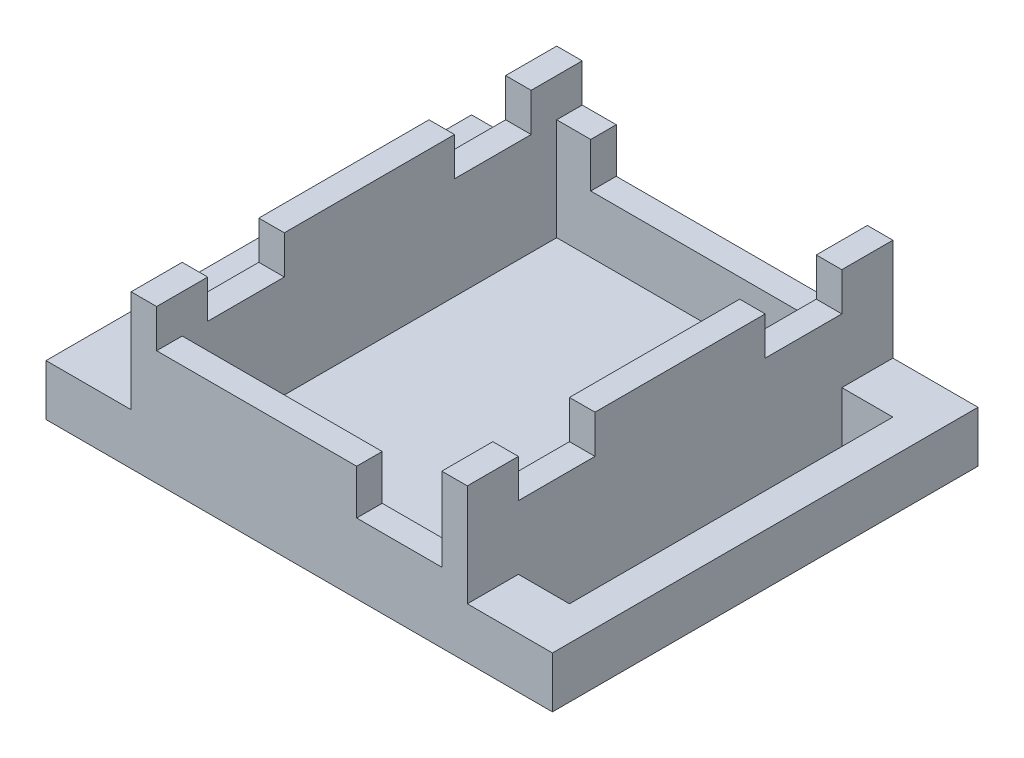
from build123d import *

# Parameters (mm, degrees)
SKETCH1_W           = 39.5
SKETCH1_H           = 50
BOSS_EXTRUDE1_DEPTH = 1.5
SKETCH3_W           = 39.5
SKETCH3_H           = 50
SKETCH3_W_2         = 33.5
SKETCH3_H_2         = 44
BOSS_EXTRUDE2_DEPTH = 12
SKETCH6_W           = 10
SKETCH6_H           = 6
CUT_EXTRUDE2_DEPTH  = 11.2
SKETCH7_W           = 29.5
SKETCH7_H           = 5.98
CUT_EXTRUDE3_DEPTH  = 3.3
SKETCH8_W           = 6
SKETCH8_H           = 6
BOSS_EXTRUDE3_DEPTH = 10
SKETCH9_W           = 4
SKETCH9_H           = 6
BOSS_EXTRUDE4_DEPTH = 38
SKETCH10_W          = 6
SKETCH10_H          = 6
BOSS_EXTRUDE5_DEPTH = 10
SKETCH11_W          = 4
SKETCH11_H          = 6
BOSS_EXTRUDE6_DEPTH = 38
SKETCH12_W          = 3
SKETCH12_H          = 6
SKETCH12_H_2        = 20
BOSS_EXTRUDE7_DEPTH = 4.5


with BuildPart() as part:
    # Sketch1 → Boss-Extrude1 (new body)
    with BuildSketch(Plane(origin=(0, 0, 0), x_dir=(1, 0, 0), z_dir=(0, 1, 0))):
        with Locations((19.75, 25)):
            Rectangle(SKETCH1_W, SKETCH1_H)
    extrude(amount=BOSS_EXTRUDE1_DEPTH)

    # Sketch3 → Boss-Extrude2 (add)
    with BuildSketch(Plane(origin=(0, 1.5, 0), x_dir=(1, 0, 0), z_dir=(0, 1, 0))):
        with Locations((19.75, 25)):
            Rectangle(SKETCH3_W, SKETCH3_H)
        with Locations((19.75, 25)):
            Rectangle(SKETCH3_W_2, SKETCH3_H_2, mode=Mode.SUBTRACT)
    extrude(amount=BOSS_EXTRUDE2_DEPTH)

    # Sketch6 → Cut-Extrude2 (cut)
    with BuildSketch(Plane.XY):
        with Locations((31.5, 11.23)):
            Rectangle(SKETCH6_W, SKETCH6_H)
    extrude(amount=-CUT_EXTRUDE2_DEPTH, mode=Mode.SUBTRACT)

    # Sketch7 → Cut-Extrude3 (cut)
    with BuildSketch(Plane(origin=(0, 0, -50), x_dir=(-1, 0, 0), z_dir=(0, 0, -1))):
        with Locations((-21.75, 11.24)):
            Rectangle(SKETCH7_W, SKETCH7_H)
    extrude(amount=-CUT_EXTRUDE3_DEPTH, mode=Mode.SUBTRACT)

    # Sketch8 → Boss-Extrude3 (add)
    with BuildSketch(Plane(origin=(39.5, 0, 0), x_dir=(0, 0, -1), z_dir=(1, 0, 0))):
        with Locations((3, 3)):
            Rectangle(SKETCH8_W, SKETCH8_H)
        with Locations((47, 3)):
            Rectangle(SKETCH8_W, SKETCH8_H)
    extrude(amount=BOSS_EXTRUDE3_DEPTH)

    # Sketch9 → Boss-Extrude4 (add)
    with BuildSketch(Plane.XY.offset(-44)):
        with Locations((47.5, 3)):
            Rectangle(SKETCH9_W, SKETCH9_H)
    extrude(amount=BOSS_EXTRUDE4_DEPTH)

    # Sketch10 → Boss-Extrude5 (add)
    with BuildSketch(Plane.ZY):
        with Locations((-47, 3)):
            Rectangle(SKETCH10_W, SKETCH10_H)
        with Locations((-3, 3)):
            Rectangle(SKETCH10_W, SKETCH10_H)
    extrude(amount=BOSS_EXTRUDE5_DEPTH)

    # Sketch11 → Boss-Extrude6 (add)
    with BuildSketch(Plane(origin=(0, 0, -6), x_dir=(-1, 0, 0), z_dir=(0, 0, -1))):
        with Locations((8, 3)):
            Rectangle(SKETCH11_W, SKETCH11_H)
    extrude(amount=BOSS_EXTRUDE6_DEPTH)

    # Sketch12 → Boss-Extrude7 (add)
    with BuildSketch(Plane(origin=(0, 13.5, 0), x_dir=(1, 0, 0), z_dir=(0, 1, 0))):
        with Locations((38, 47)):
            Rectangle(SKETCH12_W, SKETCH12_H)
        with Locations((38, 25)):
            Rectangle(SKETCH12_W, SKETCH12_H_2)
        with Locations((38, 3)):
            Rectangle(SKETCH12_W, SKETCH12_H)
        with Locations((1.5, 47)):
            Rectangle(SKETCH12_W, SKETCH12_H)
        with Locations((1.5, 25)):
            Rectangle(SKETCH12_W, SKETCH12_H_2)
        with Locations((1.5, 3)):
            Rectangle(SKETCH12_W, SKETCH12_H)
    extrude(amount=BOSS_EXTRUDE7_DEPTH)


solid = part.part
